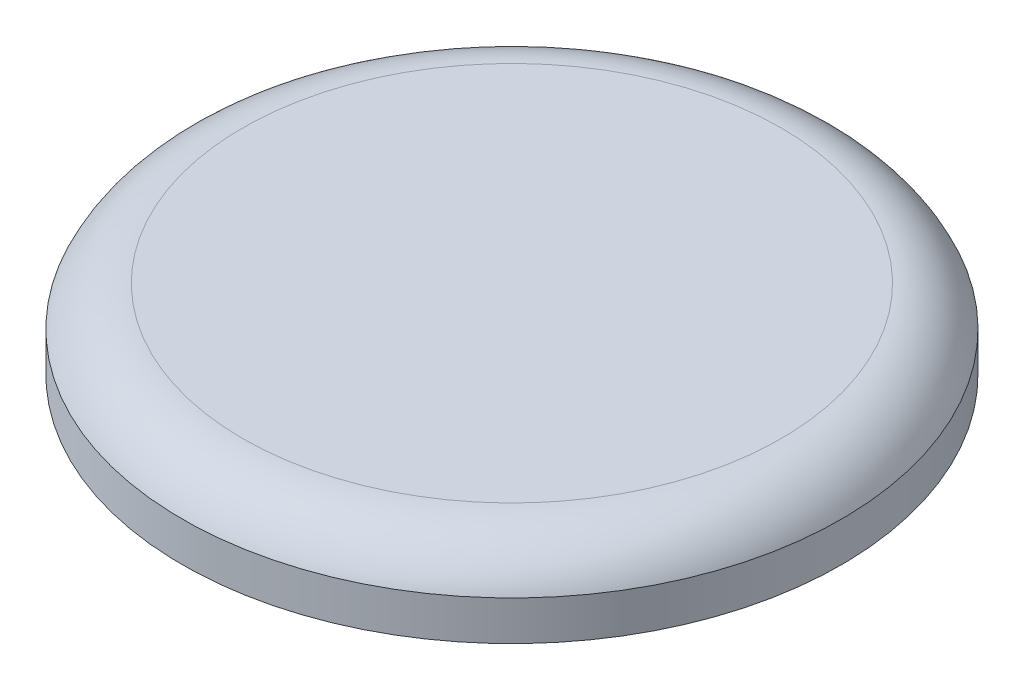
from build123d import *

# Parameters (mm, degrees)
SKETCH1_R           = 25
BOSS_EXTRUDE1_DEPTH = 3
FILLET1_R           = 5
SKETCH9_R           = 25
BOSS_EXTRUDE2_DEPTH = 3


with BuildPart() as part:
    # Sketch1 → Boss-Extrude1 (new body)
    with BuildSketch(Plane(origin=(0, 0, 0), x_dir=(1, 0, 0), z_dir=(0, 1, 0))):
        with Locations(Location((0, 0, 0), (0, 0, 270))):
            Circle(SKETCH1_R)
    extrude(amount=BOSS_EXTRUDE1_DEPTH)

    # Fillet1
    # the kernel refuses this fillet: 5 mm, written as the material it takes off along each edge
    with BuildSketch(Plane(origin=(0, 3, 0), x_dir=(0, 0, 1), z_dir=(-1, 0, 0))) as fillet1_piece_1:
        with BuildLine():
            CenterArc((20.417424305, -5), FILLET1_R, 23.578178478, 66.421821522)
            Line((20.417424305, 0), (20.417424305, 0.1))
            Line((20.417424305, 0.1), (25, 0.1))
            Line((25, 0.1), (25.1, 0))
            ThreePointArc((25.1, 0), (25.1, -1.5), (25.091651514, -2.96))
            Line((25.091651514, -2.96), (25, -3))
        make_face()
    revolve(axis=Axis((0, 3, 0), (0, 1, 0)), mode=Mode.SUBTRACT)

    # Sketch9 → Boss-Extrude2 (add)
    with BuildSketch(Plane.XZ):
        with Locations(Location((0, 0, 0), (0, 0, 270))):
            Circle(SKETCH9_R)
    extrude(amount=BOSS_EXTRUDE2_DEPTH)


solid = part.part
